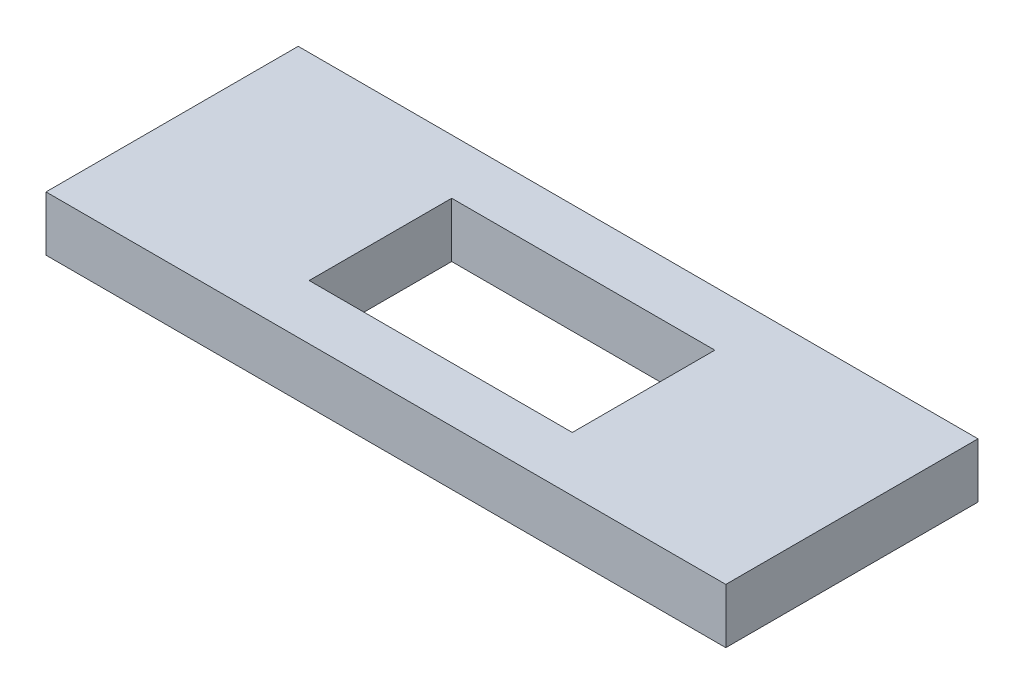
from build123d import *

# Parameters (mm, degrees)
SKETCH4_W           = 62
SKETCH4_H           = 23
SKETCH4_W_2         = 24
SKETCH4_H_2         = 13
BOSS_EXTRUDE2_DEPTH = 5


with BuildPart() as part:
    # Sketch4 → Boss-Extrude2 (new body)
    with BuildSketch(Plane(origin=(0, 0, 0), x_dir=(1, 0, 0), z_dir=(0, 1, 0))):
        with Locations((31, 11.5)):
            Rectangle(SKETCH4_W, SKETCH4_H)
        with Locations((31, 11.5)):
            Rectangle(SKETCH4_W_2, SKETCH4_H_2, mode=Mode.SUBTRACT)
    extrude(amount=BOSS_EXTRUDE2_DEPTH)


solid = part.part
